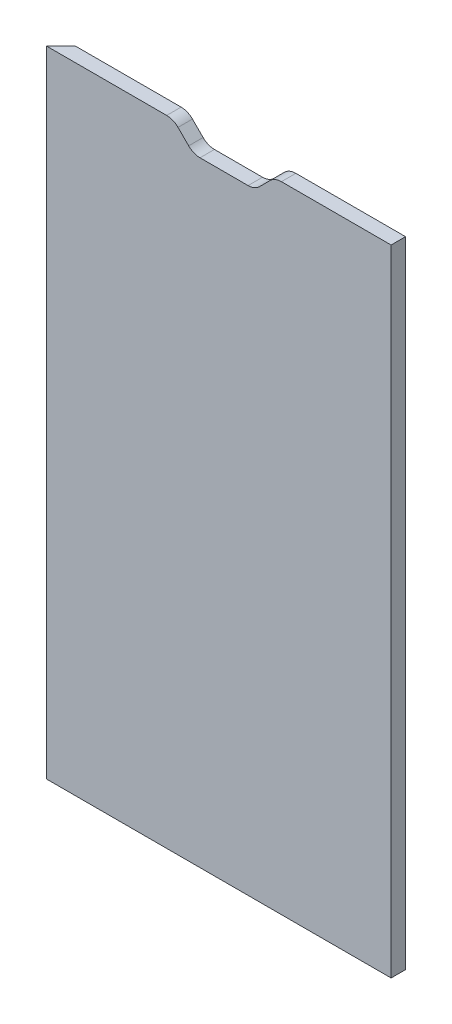
from build123d import *

# Parameters (mm, degrees)
BOSS_EXTRUDE1_DEPTH = 18
CHAMFER1_START      = -1
CHAMFER1_OUTLINE_W  = 28
CHAMFER1_OUTLINE_H  = 793
CHAMFER1_DEPTH      = 13.727922061


with BuildPart() as part:
    # Sketch1 → Boss-Extrude1 (new body)
    with BuildSketch(Plane.XY):
        with BuildLine():
            Line((278.994949366, 786.142135624), (265.710678119, 772.857864376))
            ThreePointArc((265.710678119, 772.857864376), (259.222211142, 768.52240935), (251.568542495, 767))
            Line((251.568542495, 767), (191.568542495, 767))
            ThreePointArc((191.568542495, 767), (183.914873848, 768.52240935), (177.426406871, 772.857864376))
            Line((177.426406871, 772.857864376), (164.142135624, 786.142135624))
            ThreePointArc((164.142135624, 786.142135624), (157.653668647, 790.47759065), (150, 792))
            Line((150, 792), (0, 792))
            Line((0, 792), (0, 0))
            Line((0, 0), (430, 0))
            Line((430, 0), (430, 792))
            Line((430, 792), (293.13708499, 792))
            ThreePointArc((293.13708499, 792), (285.483416343, 790.47759065), (278.994949366, 786.142135624))
        make_face()
    extrude(amount=BOSS_EXTRUDE1_DEPTH)

    # Chamfer1: read off the stored shape, not the designer's step
    # Chamfer1 outline → Chamfer1 (cut)
    with BuildSketch(Plane(origin=(0, 0, 0), x_dir=(0.7071067811865471, 0, -0.707106781186548), z_dir=(0.707106781186548, 0, 0.707106781186547)).offset(CHAMFER1_START)):
        with Locations((0, 395.5)):
            Rectangle(CHAMFER1_OUTLINE_W, CHAMFER1_OUTLINE_H)
    extrude(amount=CHAMFER1_DEPTH, mode=Mode.SUBTRACT)


solid = part.part
